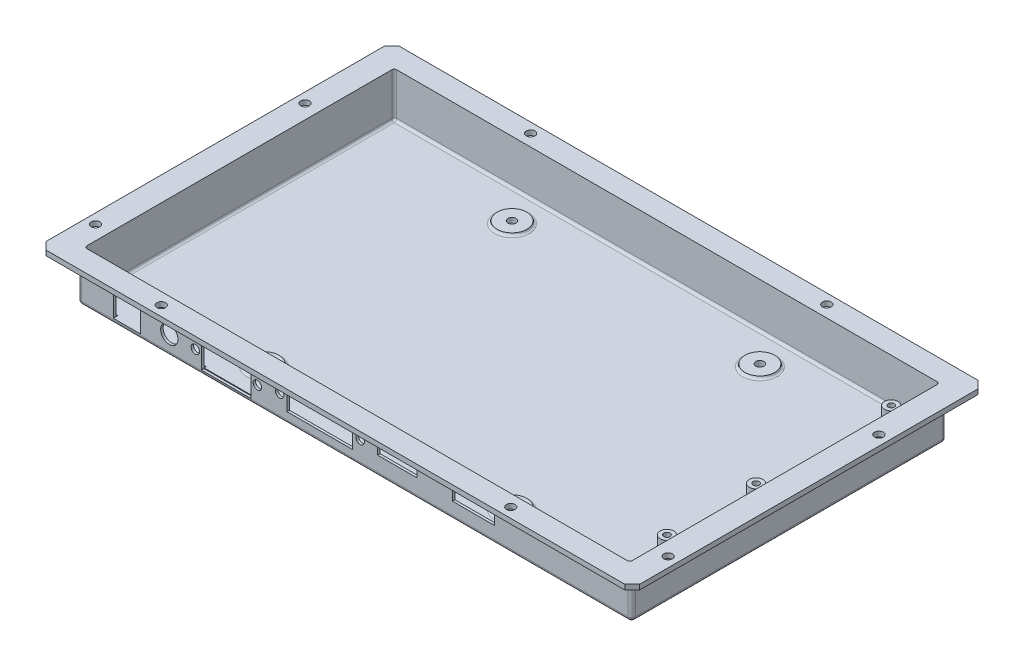
from build123d import *

# Parameters (mm, degrees)
SKETCH1_W                = 239.5
SKETCH1_H                = 142.5
BOSS_EXTRUDE1_DEPTH      = 20
SKETCH2_OUTSIDE_W        = 297.38
SKETCH2_OUTSIDE_H        = 200.38
SKETCH2_OUTSIDE_W_2      = 223.5
SKETCH2_OUTSIDE_H_2      = 127
CUT_EXTRUDE1_DEPTH       = 18
SKETCH3_W                = 220
SKETCH3_H                = 125
CUT_EXTRUDE2_DEPTH       = 18
SKETCH4_R                = 2.75
BOSS_EXTRUDE3_DEPTH      = 5
SKETCH5_R                = 1.25
CUT_EXTRUDE3_DEPTH       = 6
SKETCH6_R                = 2.75
CUT_EXTRUDE4_DEPTH       = 280.267792629
SKETCH7_R                = 1.75
CUT_EXTRUDE5_DEPTH       = 280.267792629
SKETCH8_R                = 1.7
SKETCH8_R_2              = 3.5
SKETCH8_W                = 17
SKETCH8_H                = 6.5
SKETCH8_W_2              = 16
SKETCH8_H_2              = 7
SKETCH8_W_3              = 26.5
SKETCH8_H_3              = 10
SKETCH8_W_4              = 20
SKETCH8_H_4              = 12
SKETCH8_W_5              = 11
SKETCH8_H_5              = 13
CUT_EXTRUDE6_DEPTH       = 1
CHAMFER1_SIZE            = 3
BOSS_EXTRUDE4_DEPTH      = 5
BOSS_EXTRUDE4_DEPTH_BACK = 3
SKETCH9_R                = 6
SKETCH10_R               = 1.65
CUT_EXTRUDE7_DEPTH       = 280.80618292
FILLET1_R                = 2
FILLET2_R                = 1
FILLET3_R                = 1.5
FILLET4_R                = 1


with BuildPart() as part:
    # Sketch1 → Boss-Extrude1 (new body)
    with BuildSketch(Plane(origin=(0, 0, 0), x_dir=(1, 0, 0), z_dir=(0, 1, 0))):
        with Locations((119.75, 71.25)):
            Rectangle(SKETCH1_W, SKETCH1_H)
    extrude(amount=BOSS_EXTRUDE1_DEPTH)

    # Sketch2 outside → Cut-Extrude1 (cut)
    with BuildSketch(Plane.XZ):
        with Locations((119.75, -71.25)):
            Rectangle(SKETCH2_OUTSIDE_W, SKETCH2_OUTSIDE_H)
        with Locations((119.75, -71.25)):
            Rectangle(SKETCH2_OUTSIDE_W_2, SKETCH2_OUTSIDE_H_2, mode=Mode.SUBTRACT)
    extrude(amount=-CUT_EXTRUDE1_DEPTH, mode=Mode.SUBTRACT)

    # Sketch3 → Cut-Extrude2 (cut)
    with BuildSketch(Plane(origin=(0, 20, 0), x_dir=(1, 0, 0), z_dir=(0, 1, 0))):
        with Locations((119.75, 71.25)):
            Rectangle(SKETCH3_W, SKETCH3_H)
    extrude(amount=-CUT_EXTRUDE2_DEPTH, mode=Mode.SUBTRACT)

    # Sketch4 → Boss-Extrude3 (add)
    with BuildSketch(Plane(origin=(0, 2, 0), x_dir=(1, 0, 0), z_dir=(0, 1, 0))):
        with Locations(Location((214.75, 129.25, 0), (0, 0, 270))):
            Circle(SKETCH4_R)
        with Locations(Location((214.75, 74.75, 0), (0, 0, 270))):
            Circle(SKETCH4_R)
        with Locations(Location((214.75, 38.75, 0), (0, 0, 270))):
            Circle(SKETCH4_R)
    extrude(amount=BOSS_EXTRUDE3_DEPTH)

    # Sketch5 → Cut-Extrude3 (cut)
    with BuildSketch(Plane(origin=(0, 7, 0), x_dir=(1, 0, 0), z_dir=(0, 1, 0))):
        with Locations(Location((214.75, 129.25, 0), (0, 0, 270))):
            Circle(SKETCH5_R)
        with Locations(Location((214.75, 74.75, 0), (0, 0, 270))):
            Circle(SKETCH5_R)
        with Locations(Location((214.75, 38.75, 0), (0, 0, 270))):
            Circle(SKETCH5_R)
    extrude(amount=-CUT_EXTRUDE3_DEPTH, mode=Mode.SUBTRACT)

    # Sketch6 → Cut-Extrude4 (cut, through all)
    with BuildSketch(Plane(origin=(0, 2, 0), x_dir=(1, 0, 0), z_dir=(0, 1, 0))):
        with Locations(Location((214.85, 92.650136612, 0), (0, 0, 270))):
            Circle(SKETCH6_R)
        with Locations(Location((214.85, 82.650136612, 0), (0, 0, 270))):
            Circle(SKETCH6_R)
        with Locations(Location((214.85, 66.650136612, 0), (0, 0, 270))):
            Circle(SKETCH6_R)
        with Locations(Location((214.85, 56.650136612, 0), (0, 0, 270))):
            Circle(SKETCH6_R)
        with Locations(Location((214.85, 46.650136612, 0), (0, 0, 270))):
            Circle(SKETCH6_R)
    extrude(amount=-CUT_EXTRUDE4_DEPTH, mode=Mode.SUBTRACT)

    # Sketch7 → Cut-Extrude5 (cut, through all)
    with BuildSketch(Plane.XZ.offset(-18)):
        with Locations(Location((179.5, -138.5, 0), (0, 0, 270))):
            Circle(SKETCH7_R)
        with Locations(Location((60, -138.5, 0), (0, 0, 270))):
            Circle(SKETCH7_R)
        with Locations(Location((235.5, -103.5, 0), (0, 0, 270))):
            Circle(SKETCH7_R)
        with Locations(Location((235.5, -18.5, 0), (0, 0, 270))):
            Circle(SKETCH7_R)
        with Locations(Location((186.5, -4, 0), (0, 0, 270))):
            Circle(SKETCH7_R)
        with Locations(Location((45.5, -4, 0), (0, 0, 270))):
            Circle(SKETCH7_R)
        with Locations(Location((4, -19, 0), (0, 0, 270))):
            Circle(SKETCH7_R)
        with Locations(Location((4, -103.5, 0), (0, 0, 270))):
            Circle(SKETCH7_R)
    extrude(amount=-CUT_EXTRUDE5_DEPTH, mode=Mode.SUBTRACT)

    # Sketch8 → Cut-Extrude6 (cut)
    with BuildSketch(Plane.XY.offset(-7.75)):
        with Locations((55.5, 7.7)):
            Circle(SKETCH8_R)
        with Locations((80.5, 7.7)):
            Circle(SKETCH8_R)
        with Locations((45, 7.65)):
            Circle(SKETCH8_R_2)
        with Locations((89.5, 9.4)):
            Circle(SKETCH8_R)
        with Locations((122, 9.4)):
            Circle(SKETCH8_R)
        with Locations((167.7, 9.75)):
            Rectangle(SKETCH8_W, SKETCH8_H)
        with Locations((137, 11)):
            Rectangle(SKETCH8_W_2, SKETCH8_H_2)
        with Locations((105.75, 9.4)):
            Rectangle(SKETCH8_W_3, SKETCH8_H_3)
        with Locations((68, 7.7)):
            Rectangle(SKETCH8_W_4, SKETCH8_H_4)
        with Locations((27.9, 8.5)):
            Rectangle(SKETCH8_W_5, SKETCH8_H_5)
    extrude(amount=-CUT_EXTRUDE6_DEPTH, mode=Mode.SUBTRACT)

    # Chamfer1
    chamfer1_edges = [part.edges().sort_by_distance(p)[0] for p in [
        (0, 19, -142.5),
        (239.5, 19, -142.5),
        (239.5, 19, 0),
        (0, 19, 0),
    ]]
    chamfer(chamfer1_edges, length=CHAMFER1_SIZE)

    # Sketch9 → Boss-Extrude4 (add, two sides: drawn at the far end of the back side and taken through both)
    with BuildSketch(Plane.XZ.offset(-BOSS_EXTRUDE4_DEPTH_BACK)):
        with Locations(Location((69.75, -121.25, 0), (0, 0, 270))):
            Circle(SKETCH9_R)
        with Locations(Location((169.75, -121.25, 0), (0, 0, 270))):
            Circle(SKETCH9_R)
        with Locations(Location((69.75, -21.25, 0), (0, 0, 270))):
            Circle(SKETCH9_R)
        with Locations(Location((169.75, -21.25, 0), (0, 0, 270))):
            Circle(SKETCH9_R)
    extrude(amount=BOSS_EXTRUDE4_DEPTH + BOSS_EXTRUDE4_DEPTH_BACK)

    # Sketch10 → Cut-Extrude7 (cut, through all)
    with BuildSketch(Plane.XZ.offset(5)):
        with Locations(Location((69.75, -121.25, 0), (0, 0, 270))):
            Circle(SKETCH10_R)
        with Locations(Location((169.75, -121.25, 0), (0, 0, 270))):
            Circle(SKETCH10_R)
        with Locations(Location((169.75, -21.25, 0), (0, 0, 270))):
            Circle(SKETCH10_R)
        with Locations(Location((69.75, -21.25, 0), (0, 0, 270))):
            Circle(SKETCH10_R)
    extrude(amount=-CUT_EXTRUDE7_DEPTH, mode=Mode.SUBTRACT)

    # Fillet1
    fillet1_edges = [part.edges().sort_by_distance(p)[0] for p in [
        (69.75, 0, -115.25),
        (169.75, 0, -115.25),
        (69.75, 0, -15.25),
        (169.75, 0, -15.25),
    ]]
    fillet(fillet1_edges, radius=FILLET1_R)

    # Fillet2
    fillet2_edges = [part.edges().sort_by_distance(p)[0] for p in [
        (153.875, 2, -8.75),
        (45.7, 2, -8.75),
        (9.75, 2, -71.25),
        (9.75, 11, -8.75),
        (119.75, 2, -133.75),
        (9.75, 11, -133.75),
        (229.75, 2, -71.25),
        (229.75, 11, -133.75),
        (16.075, 2, -8.75),
        (229.75, 11, -8.75),
    ]]
    fillet(fillet2_edges, radius=FILLET2_R)

    # Fillet3
    fillet3_edges = [part.edges().sort_by_distance(p)[0] for p in [
        (119.75, 0, -7.75),
        (231.5, 0, -71.25),
        (231.5, 9, -7.75),
        (231.5, 9, -134.75),
        (119.75, 0, -134.75),
        (8, 9, -134.75),
        (8, 0, -71.25),
        (8, 9, -7.75),
    ]]
    fillet(fillet3_edges, radius=FILLET3_R)

    # Fillet4
    fillet4_edges = [part.edges().sort_by_distance(p)[0] for p in [
        (69.75, 2, -115.25),
        (169.75, 2, -115.25),
        (69.75, 2, -15.25),
        (169.75, 2, -15.25),
    ]]
    fillet(fillet4_edges, radius=FILLET4_R - 0.0001)  # a hair under: the kernel refuses the full size


solid = part.part
